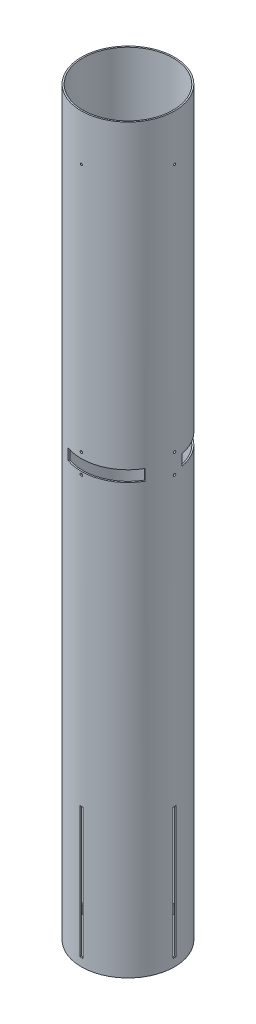
from build123d import *

# Parameters (mm, degrees)
SKETCH1_R              = 51.1048
SKETCH1_R_2            = 49.53
BOSS_EXTRUDE1_DEPTH    = 812.8
CUT_EXTRUDE1_DEPTH     = 817.00688794
CIRPATTERN1_COUNT      = 4
CUT_EXTRUDE2_DEPTH     = 817.00688794
CIRPATTERN2_COUNT      = 4
SKETCH3_R              = 3.175
CUT_EXTRUDE3_DEPTH     = 817.006888053
CUT_EXTRUDE4_START     = 470.535
CUT_EXTRUDE4_DEPTH     = 12.065
CIRPATTERN3_COUNT      = 3
LPATTERN1_COPY_1_DEPTH = 817.00688794
LPATTERN1_COPY_2_DEPTH = 817.00688794
LPATTERN1_COPY_3_DEPTH = 817.00688794
LPATTERN1_COPY_4_DEPTH = 817.00688794
SKETCH8_R              = 1.0922
CUT_EXTRUDE5_DEPTH     = 817.006888053
CIRPATTERN4_COUNT      = 4
SKETCH18_W             = 6.54812
SKETCH18_H             = 51.1048


with BuildPart() as part:
    # Sketch1 → Boss-Extrude1 (new body)
    with BuildSketch(Plane(origin=(0, 0, 0), x_dir=(1, 0, 0), z_dir=(0, 1, 0))):
        Circle(SKETCH1_R)
        Circle(SKETCH1_R_2, mode=Mode.SUBTRACT)
    extrude(amount=BOSS_EXTRUDE1_DEPTH)

    # Sketch2 → Cut-Extrude1 (cut, through all)
    with BuildSketch(Plane(origin=(0, 0, 0), x_dir=(0, 0, -1), z_dir=(1, 0, 0))):
        Polygon((0, 8.89), (1.5875, 8.89), (1.5875, 152.4), (-1.5875, 152.4), (-1.5875, 8.89), align=None)
    cut_extrude1 = extrude(amount=-CUT_EXTRUDE1_DEPTH, mode=Mode.SUBTRACT)

    # CirPattern1: Cut-Extrude1 ×4 about axis
    cirpattern1_axis = Axis((0, 0, 0), (0, 1, 0))
    for i in range(1, CIRPATTERN1_COUNT):
        add(cut_extrude1.rotate(cirpattern1_axis, i * 360 / CIRPATTERN1_COUNT), mode=Mode.SUBTRACT)

    # Sketch2<3> → Cut-Extrude2 (cut, through all)
    with BuildSketch(Plane(origin=(0, 0, 0), x_dir=(0, 0, -1), z_dir=(1, 0, 0))):
        with BuildLine():
            ThreePointArc((0, 490.30255), (-0.956397277, 487.993602723), (1.35255, 488.95))
            ThreePointArc((1.35255, 488.95), (0.956397277, 489.906397277), (0, 490.30255))
        make_face()
    cut_extrude2 = extrude(amount=-CUT_EXTRUDE2_DEPTH, mode=Mode.SUBTRACT)

    # CirPattern2: Cut-Extrude2 ×4 about axis
    cirpattern2_axis = Axis((0, 812.8, 0), (0, -1, 0))
    for i in range(1, CIRPATTERN2_COUNT):
        add(cut_extrude2.rotate(cirpattern2_axis, i * 360 / CIRPATTERN2_COUNT), mode=Mode.SUBTRACT)

    # Sketch3 → Cut-Extrude3 (cut, through all)
    with BuildSketch(Plane(origin=(0, 0, 0), x_dir=(0.7071067811865477, 0, -0.7071067811865475), z_dir=(0.7071067811865475, 0, 0.7071067811865477))):
        with Locations((0, 127)):
            Circle(SKETCH3_R)
    extrude(amount=-CUT_EXTRUDE3_DEPTH, mode=Mode.SUBTRACT)

    # Sketch7 → Cut-Extrude4 (cut)
    with BuildSketch(Plane(origin=(0, 0, 0), x_dir=(1, 0, 0), z_dir=(0, 1, 0)).offset(CUT_EXTRUDE4_START)):
        with BuildLine():
            Line((-44.258055055, -25.5524), (-42.894238249, -24.765))
            ThreePointArc((-42.894238249, -24.765), (-48.777528007, 8.60079424), (-31.837270308, 37.942181268))
            Line((-31.837270308, 37.942181268), (-32.849532236, 39.148548057))
            ThreePointArc((-32.849532236, 39.148548057), (-46.026790738, 22.208897258), (-51.086898433, 1.35255))
            ThreePointArc((-51.086898433, 1.35255), (-51.1048, 0), (-51.086898433, -1.35255))
            ThreePointArc((-51.086898433, -1.35255), (-49.184074902, -13.87902587), (-44.258055055, -25.5524))
        make_face()
    cut_extrude4 = extrude(amount=CUT_EXTRUDE4_DEPTH, mode=Mode.SUBTRACT)

    # CirPattern3: Cut-Extrude4 ×3 about axis
    cirpattern3_axis = Axis((0, 812.8, 0), (0, -1, 0))
    for i in range(1, CIRPATTERN3_COUNT):
        add(cut_extrude4.rotate(cirpattern3_axis, i * 360 / CIRPATTERN3_COUNT), mode=Mode.SUBTRACT)

    # LPattern1 copy 1 sketch → LPattern1 copy 1 (cut, through all)
    with BuildSketch(Plane(origin=(0, -21.6916, 0), x_dir=(1, 0, 0), z_dir=(0, 0, 1))):
        with BuildLine():
            ThreePointArc((0, 490.30255), (-0.956397277, 487.993602723), (1.35255, 488.95))
            ThreePointArc((1.35255, 488.95), (0.956397277, 489.906397277), (0, 490.30255))
        make_face()
    extrude(amount=-LPATTERN1_COPY_1_DEPTH, mode=Mode.SUBTRACT)

    # LPattern1 copy 2 sketch → LPattern1 copy 2 (cut, through all)
    with BuildSketch(Plane(origin=(0, -21.6916, 0), x_dir=(0, 0, 1), z_dir=(-1, 0, 0))):
        with BuildLine():
            ThreePointArc((0, 490.30255), (-0.956397277, 487.993602723), (1.35255, 488.95))
            ThreePointArc((1.35255, 488.95), (0.956397277, 489.906397277), (0, 490.30255))
        make_face()
    extrude(amount=-LPATTERN1_COPY_2_DEPTH, mode=Mode.SUBTRACT)

    # LPattern1 copy 3 sketch → LPattern1 copy 3 (cut, through all)
    with BuildSketch(Plane(origin=(0, -21.6916, 0), x_dir=(-1, 0, 0), z_dir=(0, 0, -1))):
        with BuildLine():
            ThreePointArc((0, 490.30255), (-0.956397277, 487.993602723), (1.35255, 488.95))
            ThreePointArc((1.35255, 488.95), (0.956397277, 489.906397277), (0, 490.30255))
        make_face()
    extrude(amount=-LPATTERN1_COPY_3_DEPTH, mode=Mode.SUBTRACT)

    # LPattern1 copy 4 sketch → LPattern1 copy 4 (cut, through all)
    with BuildSketch(Plane(origin=(0, -21.6916, 0), x_dir=(0, 0, -1), z_dir=(1, 0, 0))):
        with BuildLine():
            ThreePointArc((0, 490.30255), (-0.956397277, 487.993602723), (1.35255, 488.95))
            ThreePointArc((1.35255, 488.95), (0.956397277, 489.906397277), (0, 490.30255))
        make_face()
    extrude(amount=-LPATTERN1_COPY_4_DEPTH, mode=Mode.SUBTRACT)

    # Sketch8 → Cut-Extrude5 (cut, through all)
    with BuildSketch(Plane.XY):
        with Locations((0, 762)):
            Circle(SKETCH8_R)
    cut_extrude5 = extrude(amount=-CUT_EXTRUDE5_DEPTH, mode=Mode.SUBTRACT)

    # CirPattern4: Cut-Extrude5 ×4 about axis
    cirpattern4_axis = Axis((0, 812.8, 0), (0, -1, 0))
    for i in range(1, CIRPATTERN4_COUNT):
        add(cut_extrude5.rotate(cirpattern4_axis, i * 360 / CIRPATTERN4_COUNT), mode=Mode.SUBTRACT)

    # Sketch18 → 1/2 Clearance Hole4 (revolve, cut)
    with BuildSketch(Plane(origin=(0, 752.856, 0), x_dir=(0, -1, 0), z_dir=(1, 0, 0))):
        with Locations((3.27406, 25.5524)):
            Rectangle(SKETCH18_W, SKETCH18_H)
    revolve(axis=Axis((0, 752.856, 6.35), (0, 0, -1)), mode=Mode.SUBTRACT)


solid = part.part
